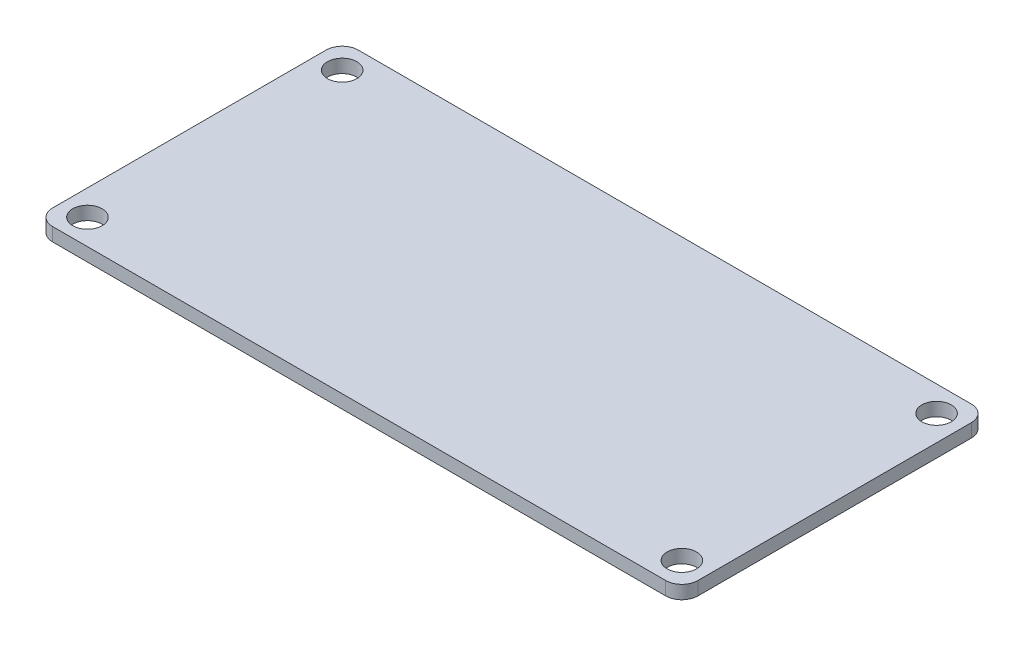
from build123d import *

# Parameters (mm, degrees)
SKETCH1_W               = 48.26
SKETCH1_H               = 22.86
BOSS_EXTRUDE1_DEPTH     = 1
CUT_EXTRUDE1_DEPTH      = 54.409804343
CUT_EXTRUDE1_DEPTH_BACK = 54.409804343
SKETCH2_R               = 1.09982
FILLET1_R               = 1.2065
SKETCH3_W               = 6.1
SKETCH3_H               = 8
BOSS_EXTRUDE2_DEPTH     = 3.5


with BuildPart() as part:
    # Sketch1 → Boss-Extrude1 (new body)
    with BuildSketch(Plane(origin=(0, 0, 0), x_dir=(1, 0, 0), z_dir=(0, 1, 0))):
        with Locations((24.13, 11.43)):
            Rectangle(SKETCH1_W, SKETCH1_H)
    extrude(amount=BOSS_EXTRUDE1_DEPTH)

    # Sketch2 → Cut-Extrude1 (cut, two sides: drawn at the far end of the back side and taken through both)
    with BuildSketch(Plane(origin=(0, 1, 0), x_dir=(1, 0, 0), z_dir=(0, 1, 0)).offset(-CUT_EXTRUDE1_DEPTH_BACK)):
        with Locations((1.905, 20.955)):
            Circle(SKETCH2_R)
        with Locations((1.905, 1.905)):
            Circle(SKETCH2_R)
        with Locations((46.355, 1.905)):
            Circle(SKETCH2_R)
        with Locations((46.355, 20.955)):
            Circle(SKETCH2_R)
    extrude(amount=CUT_EXTRUDE1_DEPTH + CUT_EXTRUDE1_DEPTH_BACK, mode=Mode.SUBTRACT)

    # Fillet1
    fillet1_edges = [part.edges().sort_by_distance(p)[0] for p in [
        (48.26, 0.5, -22.86),
        (48.26, 0.5, 0),
        (0, 0.5, -22.86),
        (0, 0.5, 0),
    ]]
    fillet(fillet1_edges, radius=FILLET1_R)

    # Sketch3 → Boss-Extrude2 (add)
    with BuildSketch(Plane.XZ):
        with Locations((2.05, -11.43)):
            Rectangle(SKETCH3_W, SKETCH3_H)
    extrude(amount=BOSS_EXTRUDE2_DEPTH)


solid = part.part
